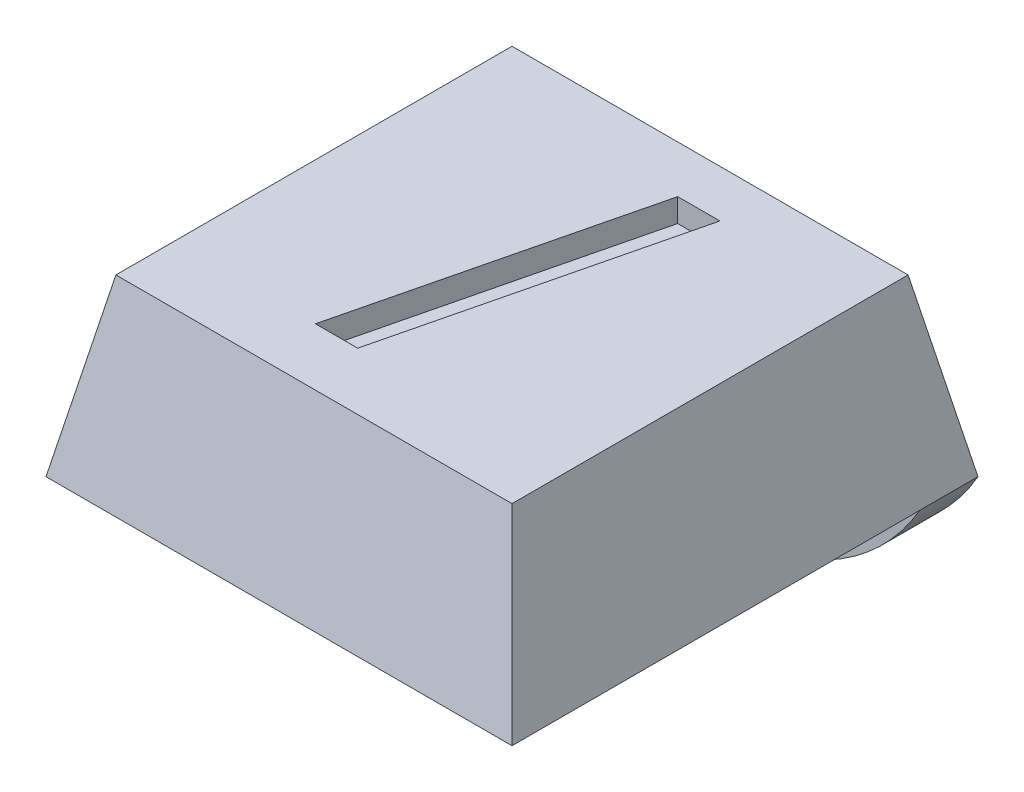
from build123d import *

# Parameters (mm, degrees)
SKETCH1_W               = 8
SKETCH1_H               = 8
BOSS_EXTRUDE1_DEPTH     = 3
CUT_EXTRUDE1_DEPTH      = 12.704699911
CUT_EXTRUDE1_DEPTH_BACK = 12.704699911
CUT_EXTRUDE2_DEPTH      = 11
SKETCH4_R               = 1.8
CUT_EXTRUDE3_DEPTH      = 0.8
SKETCH5_W               = 8
SKETCH5_H               = 1
BOSS_EXTRUDE2_DEPTH     = 2
FILLET1_R               = 4
CUT_EXTRUDE4_DEPTH      = 0.4


with BuildPart() as part:
    # Sketch1 → Boss-Extrude1 (new body)
    with BuildSketch(Plane(origin=(0, 0, 0), x_dir=(1, 0, 0), z_dir=(0, 1, 0))):
        with Locations((4, 4)):
            Rectangle(SKETCH1_W, SKETCH1_H)
    extrude(amount=BOSS_EXTRUDE1_DEPTH)

    # Sketch2 → Cut-Extrude1 (cut, two sides: drawn at the far end of the back side and taken through both)
    with BuildSketch(Plane.XY.offset(-CUT_EXTRUDE1_DEPTH_BACK)):
        Polygon((0, 0), (0.6, 3), (0, 3), align=None)
        Polygon((8, 0), (7.4, 3), (8, 3), align=None)
    extrude(amount=CUT_EXTRUDE1_DEPTH + CUT_EXTRUDE1_DEPTH_BACK, mode=Mode.SUBTRACT)

    # Sketch3 → Cut-Extrude2 (cut)
    with BuildSketch(Plane(origin=(0, 0, 0), x_dir=(0, 0, -1), z_dir=(1, 0, 0))):
        Polygon((0, 0), (0.6, 3), (0, 3), align=None)
        Polygon((8, 3), (7.4, 3), (8, 0), align=None)
    extrude(amount=CUT_EXTRUDE2_DEPTH, mode=Mode.SUBTRACT)

    # Sketch4 → Cut-Extrude3 (cut)
    with BuildSketch(Plane.XZ):
        with Locations(Location((4, -3.75, 0), (0, 0, 270))):
            Circle(SKETCH4_R)
    extrude(amount=-CUT_EXTRUDE3_DEPTH, mode=Mode.SUBTRACT)

    # Sketch5 → Boss-Extrude2 (add)
    with BuildSketch(Plane.XZ):
        with Locations((4, -7.5)):
            Rectangle(SKETCH5_W, SKETCH5_H)
    extrude(amount=BOSS_EXTRUDE2_DEPTH)

    # Fillet1
    # the kernel refuses this fillet: 4 mm, written as the material it takes off along each edge
    with BuildSketch(Plane(origin=(8, -2, -16.660254038), x_dir=(0, 1, 0), z_dir=(0, 0, 1)), Plane(origin=(0, -2, 1.660254038), x_dir=(0, 1, 0), z_dir=(0, 0, -1))) as fillet1_piece_1:
        with BuildLine():
            CenterArc((4, 3.464101615), FILLET1_R, 180, 60)
            Line((0, 3.464101615), (-0.08, 3.464101615))
            Line((-0.08, 3.464101615), (-0.08, 0))
            Line((-0.08, 0), (0, -0.08))
            ThreePointArc((0, -0.08), (1, -0.08), (1.96, -0.069282032))
            Line((1.96, -0.069282032), (2, 0))
        make_face()
    extrude(amount=18.320508076, mode=Mode.SUBTRACT)

    # Sketch6 → Cut-Extrude4 (cut)
    with BuildSketch(Plane(origin=(0, 3, 0), x_dir=(1, 0, 0), z_dir=(0, 1, 0))):
        Polygon((3.039241423, 1.586469201), (4.258191744, 6.586469201), (4.982350398, 6.586469201), (3.76440168, 1.586469201), align=None)
    extrude(amount=-CUT_EXTRUDE4_DEPTH, mode=Mode.SUBTRACT)


solid = part.part
